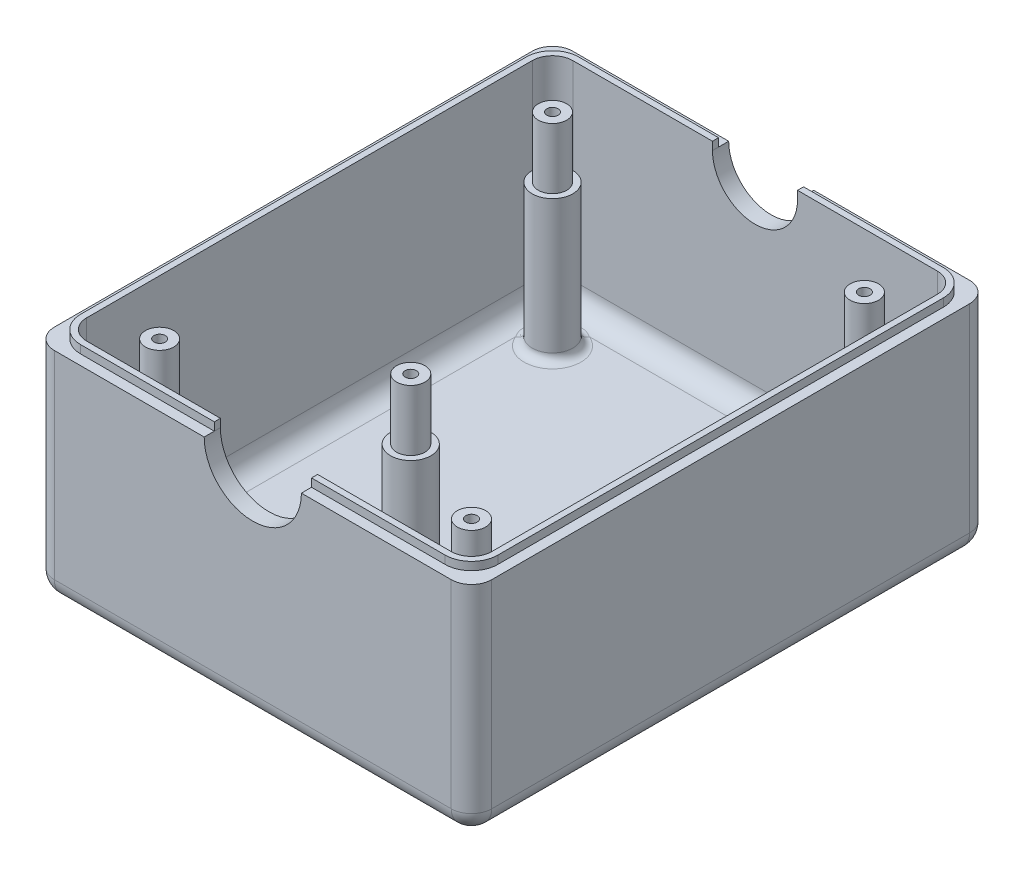
from build123d import *

# Parameters (mm, degrees)
EXTRUDE_THIN2_DEPTH      = 120
EXTRUDE_THIN3_DEPTH      = 54
EXTRUDE_THIN4_DEPTH      = 54
FILLET1_R                = 5
FILLET2_R                = 5
FILLET3_R                = 5
FILLET4_R                = 5
FILLET5_R                = 5
SKETCH8_R                = 5
BOSS_EXTRUDE1_DEPTH      = 35
SKETCH10_R               = 3.5
BOSS_EXTRUDE2_DEPTH      = 15
SKETCH11_R               = 1.4
CUT_EXTRUDE1_DEPTH       = 28
SKETCH38_R               = 12
CUT_EXTRUDE8_DEPTH       = 30
FILLET13_R               = 2
CUT_EXTRUDE9_DEPTH       = 32
CUT_EXTRUDE9_DEPTH_BACK  = 32
SKETCH40_R               = 3.75
CUT_EXTRUDE10_DEPTH      = 32
CUT_EXTRUDE10_DEPTH_BACK = 32
SKETCH41_R               = 3.75
SKETCH44_W               = 1.5
SKETCH44_H               = 110
EXTRUDE_THIN8_DEPTH      = 2
SKETCH50_W               = 1.5
SKETCH50_H               = 110
EXTRUDE_THIN12_DEPTH     = 2
EXTRUDE_THIN13_DEPTH     = 2
EXTRUDE_THIN14_DEPTH     = 2
EXTRUDE_THIN15_START     = 2
EXTRUDE_THIN15_DEPTH     = 2
SKETCH60_R               = 10.5
CUT_EXTRUDE13_DEPTH      = 10
SKETCH61_W               = 21
SKETCH61_H               = 2.752344639
CUT_EXTRUDE14_DEPTH      = 10
FILLET14_R               = 2
SKETCH65_R               = 1.75
CUT_EXTRUDE17_DEPTH      = 10


with BuildPart() as part:
    # Sketch2 → Extrude-Thin2 (new body)
    with BuildSketch(Plane.XY):
        Polygon((-50, 50), (-50, 0), (50, 0), (50, 50), (54, 50), (54, -4), (-54, -4), (-54, 50), align=None)
    extrude(amount=EXTRUDE_THIN2_DEPTH)

    # Sketch5 → Extrude-Thin3 (add)
    with BuildSketch(Plane(origin=(0, 50, 0), x_dir=(1, 0, 0), z_dir=(0, 1, 0))):
        Polygon((-54, -120), (-50, -120), (50, -120), (54, -120), (54, -124), (50, -124), (-50, -124), (-54, -124), align=None)
    extrude(amount=-EXTRUDE_THIN3_DEPTH)

    # Sketch7 → Extrude-Thin4 (add)
    with BuildSketch(Plane(origin=(0, 50, 0), x_dir=(1, 0, 0), z_dir=(0, 1, 0))):
        Polygon((-54, 0), (-50, 0), (50, 0), (54, 0), (54, 4), (50, 4), (-50, 4), (-54, 4), align=None)
    extrude(amount=-EXTRUDE_THIN4_DEPTH)

    # Fillet1
    fillet1_edges = [part.edges().sort_by_distance(p)[0] for p in [
        (54, -4, 60),
        (-54, -4, 60),
        (-54, 23, 124),
        (0, -4, 124),
        (54, 23, -4),
        (0, -4, -4),
        (-54, 23, -4),
    ]]
    fillet(fillet1_edges, radius=FILLET1_R)

    # Fillet2
    # the kernel refuses this fillet: 5 mm, written as the material it takes off along each edge
    with BuildSketch(Plane(origin=(49, 1, 119), x_dir=(1, 0, 0), z_dir=(0, 0, 1))) as fillet2_piece_1_section:
        Polygon((0, 0), (FILLET2_R, 0), (FILLET2_R, -FILLET2_R), (0, -FILLET2_R), align=None)
    fillet2_piece_1 = extrude(amount=FILLET2_R, mode=Mode.PRIVATE)
    fillet2_piece_1 = fillet2_piece_1 - Plane(origin=(49, 1, 119), x_dir=(-0.7071067811865477, 0.7071067811865474, 0), z_dir=(0, 0, 1)) * Sphere(FILLET2_R, mode=Mode.PRIVATE)
    add(fillet2_piece_1, mode=Mode.SUBTRACT)
    with BuildSketch(Plane(origin=(54, 62.5, 124), x_dir=(-1, 0, 0), z_dir=(0, -1, 0))) as fillet2_piece_2:
        with BuildLine():
            CenterArc((FILLET2_R, FILLET2_R), FILLET2_R, 180, 90)
            Line((0, FILLET2_R), (0, 0))
            Line((0, 0), (FILLET2_R, 0))
        make_face()
    extrude(amount=61.5, mode=Mode.SUBTRACT)

    # Fillet3
    fillet3_edges = [part.edges().sort_by_distance(p)[0] for p in [
        (50, 0, 60),
        (0, 0, 0),
        (50, 25, 0),
    ]]
    fillet(fillet3_edges, radius=FILLET3_R)

    # Fillet4
    fillet4_edges = [part.edges().sort_by_distance(p)[0] for p in [
        (-50, 1.464466094, 1.464466094),
        (-50, 0, 62.5),
        (-50, 27.5, 0),
    ]]
    fillet(fillet4_edges, radius=FILLET4_R)

    # Fillet5
    fillet5_edges = [part.edges().sort_by_distance(p)[0] for p in [
        (50, 27.5, 120),
        (48.535533906, 1.464466094, 120),
        (0, 0, 120),
        (-48.535533906, 1.464466094, 120),
        (-50, 27.5, 120),
    ]]
    fillet(fillet5_edges, radius=FILLET5_R)

    # Sketch8 → Boss-Extrude1 (add)
    with BuildSketch(Plane(origin=(0, 0, 0), x_dir=(1, 0, 0), z_dir=(0, 1, 0))):
        with Locations(Location((38.5, -11.5, 0), (0, 0, 180))):
            Circle(SKETCH8_R)
        with Locations((-38.5, -11.5)):
            Circle(SKETCH8_R)
        with Locations((-38.5, -108.5)):
            Circle(SKETCH8_R)
        with Locations(Location((38.5, -108.5, 0), (0, 0, 180))):
            Circle(SKETCH8_R)
        with Locations(Location((0, -85, 0), (0, 0, 180))):
            Circle(SKETCH8_R)
    extrude(amount=BOSS_EXTRUDE1_DEPTH)

    # Sketch10 → Boss-Extrude2 (add)
    with BuildSketch(Plane(origin=(0, 35, 0), x_dir=(1, 0, 0), z_dir=(0, 1, 0))):
        with Locations(Location((38.5, -11.5, 0), (0, 0, 270))):
            Circle(SKETCH10_R)
        with Locations((-38.5, -11.5)):
            Circle(SKETCH10_R)
        with Locations(Location((0, -85, 0), (0, 0, 270))):
            Circle(SKETCH10_R)
        with Locations(Location((-38.5, -108.5, 0), (0, 0, 270))):
            Circle(SKETCH10_R)
        with Locations((38.5, -108.5)):
            Circle(SKETCH10_R)
    extrude(amount=BOSS_EXTRUDE2_DEPTH)

    # Sketch11 → Cut-Extrude1 (cut)
    with BuildSketch(Plane(origin=(0, 50, 0), x_dir=(1, 0, 0), z_dir=(0, 1, 0))):
        with Locations(Location((-38.5, -11.5, 0), (0, 0, 180))):
            Circle(SKETCH11_R)
        with Locations((38.5, -11.5)):
            Circle(SKETCH11_R)
        with Locations(Location((-38.5, -108.5, 0), (0, 0, 180))):
            Circle(SKETCH11_R)
        with Locations((38.5, -108.5)):
            Circle(SKETCH11_R)
        with Locations(Location((0, -85, 0), (0, 0, 180))):
            Circle(SKETCH11_R)
    extrude(amount=-CUT_EXTRUDE1_DEPTH, mode=Mode.SUBTRACT)

    # Sketch38 → Cut-Extrude8 (cut)
    with BuildSketch(Plane.XY.offset(124)):
        with Locations((0, 50)):
            Circle(SKETCH38_R)
    extrude(amount=-CUT_EXTRUDE8_DEPTH, mode=Mode.SUBTRACT)

    # Fillet13
    fillet13_edges = [part.edges().sort_by_distance(p)[0] for p in [
        (-43.5, 0, 108.5),
    ]]
    fillet(fillet13_edges, radius=FILLET13_R)

    # Sketch40 → Cut-Extrude9 (cut, two sides: drawn at the far end of the back side and taken through both)
    with BuildSketch(Plane(origin=(0, 0, 0), x_dir=(1, 0, 0), z_dir=(0, 1, 0)).offset(-CUT_EXTRUDE9_DEPTH_BACK)):
        with Locations(Location((-38.5, -11.5, 0), (0, 0, 180))):
            Circle(SKETCH40_R)
    extrude(amount=CUT_EXTRUDE9_DEPTH + CUT_EXTRUDE9_DEPTH_BACK, mode=Mode.SUBTRACT)

    # Sketch41 → Cut-Extrude10 (cut, two sides: drawn at the far end of the back side and taken through both)
    with BuildSketch(Plane(origin=(0, 0, 0), x_dir=(1, 0, 0), z_dir=(0, 1, 0)).offset(-CUT_EXTRUDE10_DEPTH_BACK)):
        with Locations(Location((38.5, -11.5, 0), (0, 0, 180))):
            Circle(SKETCH41_R)
        with Locations(Location((0, -85, 0), (0, 0, 180))):
            Circle(SKETCH41_R)
        with Locations(Location((-38.5, -108.5, 0), (0, 0, 180))):
            Circle(SKETCH41_R)
        with Locations(Location((38.5, -108.5, 0), (0, 0, 180))):
            Circle(SKETCH41_R)
    extrude(amount=CUT_EXTRUDE10_DEPTH + CUT_EXTRUDE10_DEPTH_BACK, mode=Mode.SUBTRACT)

    # Sketch44 → Extrude-Thin8 (add)
    with BuildSketch(Plane(origin=(0, 50, 0), x_dir=(1, 0, 0), z_dir=(0, 1, 0))):
        with Locations((50.75, -60)):
            Rectangle(SKETCH44_W, SKETCH44_H)
    extrude(amount=EXTRUDE_THIN8_DEPTH)

    # Sketch50 → Extrude-Thin12 (add)
    with BuildSketch(Plane(origin=(0, 50, 0), x_dir=(1, 0, 0), z_dir=(0, 1, 0))):
        with Locations((-50.75, -60)):
            Rectangle(SKETCH50_W, SKETCH50_H)
    extrude(amount=EXTRUDE_THIN12_DEPTH)

    # Sketch51 → Extrude-Thin13 (add)
    with BuildSketch(Plane(origin=(0, 50, 0), x_dir=(1, 0, 0), z_dir=(0, 1, 0))):
        with BuildLine():
            ThreePointArc((-50, -5), (-48.535533906, -1.464466094), (-45, 0))
            Line((-45, 0), (45, 0))
            ThreePointArc((45, 0), (48.535533906, -1.464466094), (50, -5))
            Line((50, -5), (51.5, -5))
            ThreePointArc((51.5, -5), (49.596194078, -0.403805922), (45, 1.5))
            Line((45, 1.5), (-45, 1.5))
            ThreePointArc((-45, 1.5), (-49.596194078, -0.403805922), (-51.5, -5))
            Line((-51.5, -5), (-50, -5))
        make_face()
    extrude(amount=EXTRUDE_THIN13_DEPTH)

    # Sketch52 → Extrude-Thin14 (add)
    with BuildSketch(Plane(origin=(0, 50, 0), x_dir=(1, 0, 0), z_dir=(0, 1, 0))):
        with BuildLine():
            ThreePointArc((-50, -115), (-48.535533906, -118.535533906), (-45, -120))
            Line((-45, -120), (-12, -120))
            Line((-12, -120), (-12, -121.5))
            Line((-12, -121.5), (-45, -121.5))
            ThreePointArc((-45, -121.5), (-49.596194078, -119.596194078), (-51.5, -115))
            Line((-51.5, -115), (-50, -115))
        make_face()
    extrude(amount=EXTRUDE_THIN14_DEPTH)

    # Sketch53 → Extrude-Thin15 (add)
    with BuildSketch(Plane(origin=(0, 50, 0), x_dir=(1, 0, 0), z_dir=(0, 1, 0)).offset(EXTRUDE_THIN15_START)):
        with BuildLine():
            ThreePointArc((50, -115), (48.535533906, -118.535533906), (45, -120))
            Line((45, -120), (12, -120))
            Line((12, -120), (12, -121.5))
            Line((12, -121.5), (45, -121.5))
            ThreePointArc((45, -121.5), (49.596194078, -119.596194078), (51.5, -115))
            Line((51.5, -115), (50, -115))
        make_face()
    extrude(amount=-EXTRUDE_THIN15_DEPTH)

    # Sketch60 → Cut-Extrude13 (cut)
    with BuildSketch(Plane(origin=(0, 0, -4), x_dir=(-1, 0, 0), z_dir=(0, 0, -1))):
        with Locations((0, 50)):
            Circle(SKETCH60_R)
    extrude(amount=-CUT_EXTRUDE13_DEPTH, mode=Mode.SUBTRACT)

    # Sketch61 → Cut-Extrude14 (cut)
    with BuildSketch(Plane(origin=(0, 0, -4), x_dir=(-1, 0, 0), z_dir=(0, 0, -1))):
        with Locations((0, 51.37617232)):
            Rectangle(SKETCH61_W, SKETCH61_H)
    extrude(amount=-CUT_EXTRUDE14_DEPTH, mode=Mode.SUBTRACT)

    # Fillet14
    fillet14_edges = [part.edges().sort_by_distance(p)[0] for p in [
        (-43.5, 0, 11.5),
        (43.5, 0, 11.5),
        (5, 0, 85),
        (43.5, 0, 108.5),
    ]]
    fillet(fillet14_edges, radius=FILLET14_R)

    # Sketch65 → Cut-Extrude17 (cut)
    with BuildSketch(Plane.XZ.offset(-32)):
        with Locations((-38.5, 108.5)):
            Circle(SKETCH65_R)
        with Locations((-38.5, 11.5)):
            Circle(SKETCH65_R)
        with Locations((38.5, 11.5)):
            Circle(SKETCH65_R)
        with Locations(Location((38.5, 108.5, 0), (0, 0, 180))):
            Circle(SKETCH65_R)
        with Locations((0, 85)):
            Circle(SKETCH65_R)
    extrude(amount=-CUT_EXTRUDE17_DEPTH, mode=Mode.SUBTRACT)


solid = part.part
